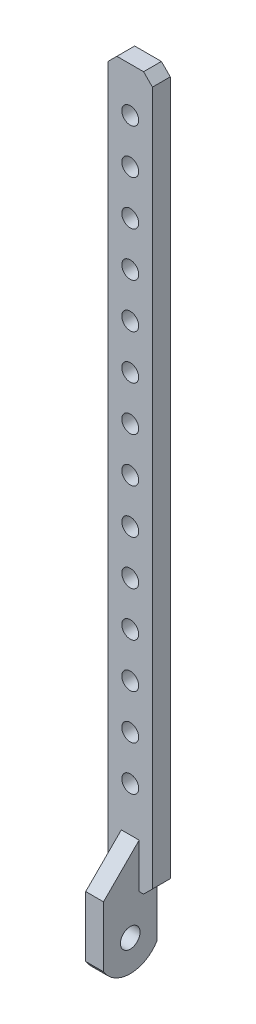
from build123d import *

# Parameters (mm, degrees)
SKETCH1_W           = 5
SKETCH1_H           = 80
BOSS_EXTRUDE1_DEPTH = 2
SKETCH3_R           = 0.95
CUT_EXTRUDE1_DEPTH  = 41.127920454
SKETCH2_W           = 2
SKETCH2_H           = 8
BOSS_EXTRUDE2_DEPTH = 6
CUT_EXTRUDE2_REACH  = 50.5
SKETCH4_R           = 1.1
CHAMFER1_SIZE       = 5
CHAMFER2_SIZE       = 1


with BuildPart() as part:
    # Sketch1 → Boss-Extrude1 (new body)
    with BuildSketch(Plane.XY):
        Rectangle(SKETCH1_W, SKETCH1_H)
    extrude(amount=BOSS_EXTRUDE1_DEPTH)

    # Sketch3 → Cut-Extrude1 (cut, through all)
    with BuildSketch(Plane.XY.offset(2)):
        with Locations((0, 35)):
            Circle(SKETCH3_R)
        with Locations((0, 30)):
            Circle(SKETCH3_R)
        with Locations((0, 25)):
            Circle(SKETCH3_R)
        with Locations((0, 20)):
            Circle(SKETCH3_R)
        with Locations((0, 15)):
            Circle(SKETCH3_R)
        with Locations((0, 10)):
            Circle(SKETCH3_R)
        with Locations((0, 5)):
            Circle(SKETCH3_R)
        Circle(SKETCH3_R)
        with Locations((0, -5)):
            Circle(SKETCH3_R)
        with Locations((0, -10)):
            Circle(SKETCH3_R)
        with Locations((0, -15)):
            Circle(SKETCH3_R)
        with Locations((0, -20)):
            Circle(SKETCH3_R)
        with Locations((0, -25)):
            Circle(SKETCH3_R)
        with Locations((0, -30)):
            Circle(SKETCH3_R)
    extrude(amount=-CUT_EXTRUDE1_DEPTH, mode=Mode.SUBTRACT)

    # Sketch2 → Boss-Extrude2 (add)
    with BuildSketch(Plane(origin=(0, 0, 0), x_dir=(-1, 0, 0), z_dir=(0, 0, -1))):
        with Locations((0, -44)):
            Rectangle(SKETCH2_W, SKETCH2_H)
    extrude(amount=-BOSS_EXTRUDE2_DEPTH)

    # Sketch4 → Cut-Extrude2 (cut, up to next)
    with BuildSketch(Plane.ZY.offset(1), mode=Mode.PRIVATE) as cut_extrude2_sk1:
        with Locations((3, -44)):
            Circle(SKETCH4_R)
    cut_extrude2_tool1 = extrude(cut_extrude2_sk1.sketch, amount=-CUT_EXTRUDE2_REACH, mode=Mode.PRIVATE) & part.part
    # Sketch4 → Cut-Extrude2 (cut, up to next)
    with BuildSketch(Plane.ZY.offset(1), mode=Mode.PRIVATE) as cut_extrude2_sk2:
        with BuildLine():
            Line((0, -45.802775638), (0, -48))
            Line((0, -48), (6, -48))
            Line((6, -48), (6, -45.802775638))
            ThreePointArc((6, -45.802775638), (3, -47.5), (0, -45.802775638))
        make_face()
    cut_extrude2_tool2 = extrude(cut_extrude2_sk2.sketch, amount=-CUT_EXTRUDE2_REACH, mode=Mode.PRIVATE) & part.part
    add(cut_extrude2_tool1.solids().sort_by_distance((-1, -44, 3))[0], mode=Mode.SUBTRACT)
    add(cut_extrude2_tool2.solids().sort_by_distance((-1, -47.563897, 3))[0], mode=Mode.SUBTRACT)

    # Chamfer1
    # the kernel refuses this chamfer: 5 mm, written as the material it adds along each edge
    with BuildSketch(Plane(origin=(-1, -40, 2), x_dir=(0, 0.9996219169112968, -0.02749587661058636), z_dir=(1, 0, 0))) as chamfer1_piece_1_section:
        Polygon((CHAMFER1_SIZE * 0.999621916911, CHAMFER1_SIZE * 0.0274958766106), (-CHAMFER1_SIZE * 0.0274958766106, CHAMFER1_SIZE * 0.999621916911), (0, 0), align=None)
    chamfer1_piece_1 = extrude(amount=2, mode=Mode.PRIVATE)
    chamfer1_piece_1 = split(chamfer1_piece_1, bisect_by=Plane(origin=(0, -38.277777778, 6), z_dir=(0, 0, -1)), keep=Keep.TOP, mode=Mode.PRIVATE)
    add(chamfer1_piece_1)

    # Chamfer2
    chamfer2_edges = [part.edges().sort_by_distance(p)[0] for p in [
        (-2.5, 40, 1),
        (2.5, 40, 1),
        (-2.5, -40, 1),
        (2.5, -40, 1),
    ]]
    chamfer(chamfer2_edges, length=CHAMFER2_SIZE)


solid = part.part
